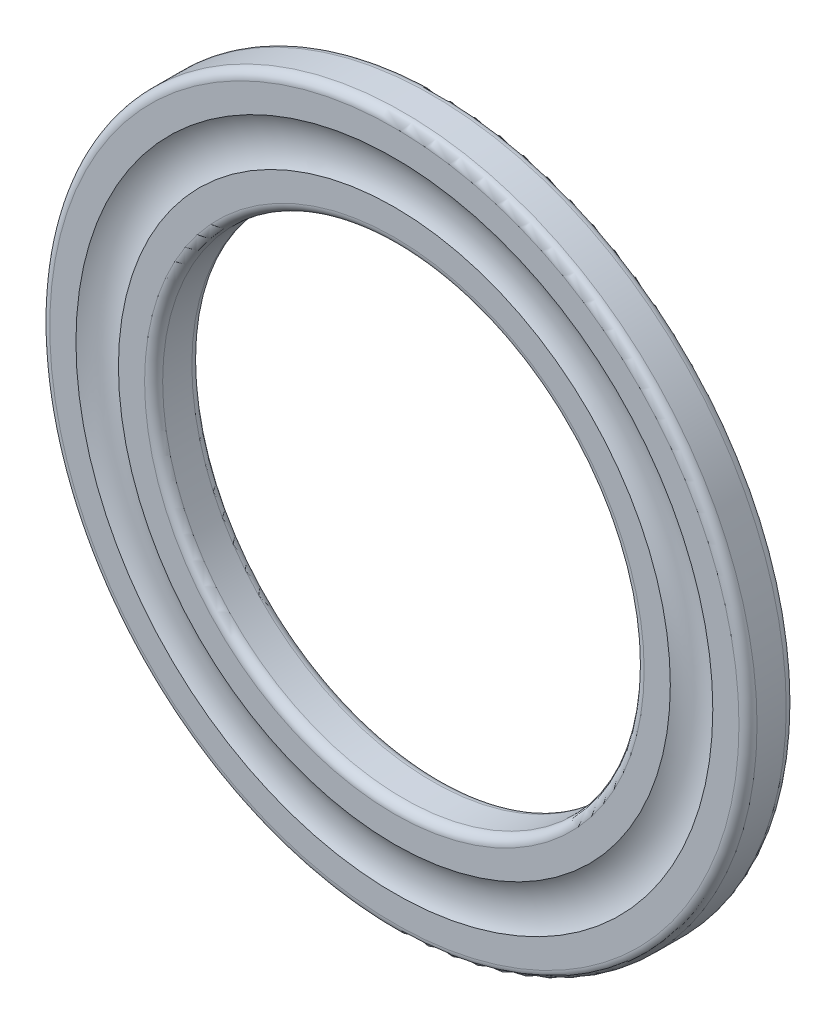
from build123d import *

# Parameters (mm, degrees)
ESQUISSE1_R        = 23.5
ESQUISSE1_R_2      = 16
BOSS_EXTRU_1_DEPTH = 3.14
ESQUISSE2_R        = 2.75
CONG_1_R           = 0.6
ENROULEMENT2_START = -0.1
ENROULEMENT2_DEPTH = 0.1


# Read off the part's stored shape, not the designer's step: Enroulement2
with BuildPart() as part:
    # Esquisse1 → Boss.-Extru.1 (new body)
    with BuildSketch(Plane.XY):
        Circle(ESQUISSE1_R)
        Circle(ESQUISSE1_R_2, mode=Mode.SUBTRACT)
    extrude(amount=BOSS_EXTRU_1_DEPTH)

    # Esquisse2 → Enlèvement de matière-Révolution1 (revolve, cut)
    with BuildSketch(Plane(origin=(0, 0, 0), x_dir=(1, 0, 0), z_dir=(0, 1, 0)), mode=Mode.PRIVATE) as enl_vement_de_mati_re_r_volution1_sk:
        with Locations((19.75, -5.5)):
            Circle(ESQUISSE2_R)
    revolve(enl_vement_de_mati_re_r_volution1_sk.sketch.rotate(Axis((0, 0, 0), (0, 0, 1)), 180), axis=Axis((0, 0, 0), (0, 0, 1)), mode=Mode.SUBTRACT)

    # Congé1
    cong_1_edges = [part.edges().sort_by_distance(p)[0] for p in [
        (-23.5, 0, 0),
        (-23.5, 0, 3.14),
        (-16, 0, 0),
        (-16, 0, 3.14),
    ]]
    fillet(cong_1_edges, radius=CONG_1_R)

    # Enroulement2 outline → Enroulement2 (cut)
    # profile 1 of 8: a face of its own
    with BuildSketch(Plane(origin=(0, 0, 0), x_dir=(-1, 0, 0), z_dir=(0, 0, -1)).offset(ENROULEMENT2_START)):
        with BuildLine():
            add(Edge.make_bspline(
                [(3.714295998, -18.613120903), (3.685048727, -18.575685711), (3.629200866, -18.504202958), (3.538751716, -18.41001704), (3.44854473, -18.331535518), (3.357447083, -18.269500239), (3.265411424, -18.22493459), (3.173411821, -18.195855975), (3.080309986, -18.184330345), (3.019115051, -18.189923964), (2.988599884, -18.19271325)],
                knots=[0, 0, 0, 0, 0.161736123, 0.308836224, 0.444035035, 0.568418723, 0.683082878, 0.791131641, 0.895846728, 1, 1, 1, 1], degree=3))
            Line((3.714295998, -18.613120903), (3.956618714, -18.413411367))
            add(Edge.make_bspline(
                [(2.912913787, -17.893148947), (2.936411932, -17.890039153), (2.983062328, -17.883865341), (3.053036037, -17.880904148), (3.122109493, -17.882757294), (3.190179073, -17.889643378), (3.257219968, -17.902126478), (3.323608956, -17.918137984), (3.388533311, -17.941078226), (3.453208504, -17.967560324), (3.517370146, -18.00029591), (3.580850013, -18.039827417), (3.643987766, -18.086237481), (3.7077505, -18.138138422), (3.770554843, -18.197522631), (3.832818257, -18.263616164), (3.896207354, -18.335114258), (3.936144022, -18.386874816), (3.956618714, -18.413411367)],
                knots=[0, 0, 0, 0, 0.057710414, 0.114571328, 0.170362336, 0.225906656, 0.281007538, 0.336364313, 0.392050073, 0.448534577, 0.506500863, 0.567258904, 0.630471167, 0.697250649, 0.76739152, 0.84080712, 0.91838515, 1, 1, 1, 1], degree=3))
            add(Edge.make_bspline(
                [(2.152236703, -18.868163971), (2.148894721, -18.84000772), (2.142301634, -18.784460854), (2.142669568, -18.70131326), (2.150654387, -18.619825868), (2.168202028, -18.539955852), (2.193690709, -18.461533419), (2.227516298, -18.384660112), (2.270762145, -18.310054424), (2.321106748, -18.237662506), (2.37784846, -18.16927305), (2.44021152, -18.107435076), (2.507553814, -18.05289933), (2.579528544, -18.005726236), (2.656250877, -17.966038901), (2.7375849, -17.934393643), (2.82329844, -17.909062982), (2.882681742, -17.898517602), (2.912913787, -17.893148947)],
                knots=[0, 0, 0, 0, 0.061893002, 0.122102984, 0.181230863, 0.240460236, 0.300364831, 0.361122759, 0.423567834, 0.488450692, 0.553562922, 0.617426091, 0.679994711, 0.742554759, 0.805113093, 0.868328059, 0.932965801, 1, 1, 1, 1], degree=3))
            add(Edge.make_bspline(
                [(3.010224484, -19.766220863), (2.973828764, -19.746760427), (2.903408895, -19.709107611), (2.803311797, -19.650156391), (2.711309352, -19.592715714), (2.627478305, -19.535885755), (2.551964495, -19.480060655), (2.484124133, -19.425719016), (2.425314199, -19.371266867), (2.358517521, -19.301561588), (2.289659504, -19.212145367), (2.223378438, -19.101377845), (2.176167688, -18.986594504), (2.160144238, -18.907297069), (2.152236703, -18.868163971)],
                knots=[0, 0, 0, 0, 0.096005536, 0.185755284, 0.270188288, 0.348299802, 0.421296901, 0.48861994, 0.550397621, 0.607610258, 0.713072398, 0.812124623, 0.907283943, 1, 1, 1, 1], degree=3))
            add(Edge.make_bspline(
                [(3.461797, -20.018083843), (3.454408375, -20.013158338), (3.436490541, -20.001213709), (3.404161956, -19.981836495), (3.361988171, -19.95779559), (3.310647329, -19.928431581), (3.249228969, -19.894772949), (3.178305841, -19.856003725), (3.097339293, -19.812898334), (3.040321686, -19.782347412), (3.010224484, -19.766220863)],
                knots=[0, 0, 0, 0, 0.05150233, 0.124896073, 0.218550018, 0.333100489, 0.467951629, 0.62478523, 0.801939867, 1, 1, 1, 1], degree=3))
            add(Edge.make_bspline(
                [(3.719384139, -20.395242297), (3.716331299, -20.378419005), (3.710223741, -20.344762067), (3.69492707, -20.295543958), (3.67348773, -20.24858832), (3.647839737, -20.201947138), (3.613710922, -20.156566816), (3.572434013, -20.109500247), (3.520159968, -20.06373028), (3.481875366, -20.033787395), (3.461797, -20.018083843)],
                knots=[0, 0, 0, 0, 0.109098253, 0.218263653, 0.327931352, 0.438232009, 0.55734855, 0.689646764, 0.837235186, 1, 1, 1, 1], degree=3))
            add(Edge.make_bspline(
                [(3.349857897, -20.856991095), (3.379834832, -20.851053243), (3.437916154, -20.839548456), (3.517945878, -20.805306749), (3.587250165, -20.758054408), (3.643649031, -20.697966252), (3.686833742, -20.629393843), (3.715959426, -20.555272677), (3.726973187, -20.475757224), (3.721960361, -20.422574357), (3.719384139, -20.395242297)],
                knots=[0, 0, 0, 0, 0.138440972, 0.268234054, 0.392111034, 0.516703857, 0.639540735, 0.758051777, 0.875656508, 1, 1, 1, 1], degree=3))
            add(Edge.make_bspline(
                [(2.720836463, -20.559334845), (2.737902983, -20.575983853), (2.770977447, -20.608249189), (2.820408562, -20.652961862), (2.866851463, -20.693563489), (2.911532727, -20.728670599), (2.954015402, -20.758837925), (2.993381971, -20.785597096), (3.031031508, -20.806435091), (3.077360989, -20.828714075), (3.135439737, -20.847528929), (3.20592135, -20.861043636), (3.277936286, -20.865495634), (3.325723949, -20.85984487), (3.349857897, -20.856991095)],
                knots=[0, 0, 0, 0, 0.098554902, 0.190996793, 0.27550786, 0.353530106, 0.425765429, 0.490911009, 0.550159448, 0.603478001, 0.703252904, 0.801401682, 0.899702953, 1, 1, 1, 1], degree=3))
            Line((2.720836463, -20.559334845), (2.49377817, -20.791481279))
            add(Edge.make_bspline(
                [(3.391835061, -21.180724068), (3.355205275, -21.184975745), (3.282675759, -21.193394362), (3.173352999, -21.187133648), (3.065569456, -21.168998874), (2.977233904, -21.141358104), (2.906887066, -21.110822887), (2.852245382, -21.082146421), (2.796163016, -21.047409878), (2.738312185, -21.007425774), (2.679399729, -20.961402211), (2.618498936, -20.910308857), (2.556547554, -20.852986913), (2.515088643, -20.812362704), (2.49377817, -20.791481279)],
                knots=[0, 0, 0, 0, 0.108170094, 0.214184287, 0.32038316, 0.428743212, 0.485099721, 0.545561823, 0.609876982, 0.678821984, 0.752086373, 0.829451871, 0.912335822, 1, 1, 1, 1], degree=3))
            add(Edge.make_bspline(
                [(4.041209059, -20.334184605), (4.04514122, -20.367633669), (4.052894978, -20.433591281), (4.047701129, -20.532519141), (4.030577888, -20.62873738), (4.000664341, -20.72162622), (3.95869297, -20.809290029), (3.905592773, -20.890724518), (3.839627296, -20.963342144), (3.764533864, -21.028712657), (3.680269287, -21.083929822), (3.589841953, -21.128674998), (3.493128259, -21.161787781), (3.425956843, -21.174345161), (3.391835061, -21.180724068)],
                knots=[0, 0, 0, 0, 0.084769184, 0.167154837, 0.248606122, 0.330574719, 0.412325255, 0.492958941, 0.574709477, 0.6588191, 0.743306487, 0.827913794, 0.912583528, 1, 1, 1, 1], degree=3))
            add(Edge.make_bspline(
                [(3.803974484, -19.880068018), (3.819846802, -19.896642791), (3.851133048, -19.929313658), (3.89433122, -19.980742228), (3.930917075, -20.035354481), (3.963885693, -20.091033454), (3.990193702, -20.14934324), (4.012970459, -20.208830091), (4.03025102, -20.270586678), (4.037543158, -20.31290856), (4.041209059, -20.334184605)],
                knots=[0, 0, 0, 0, 0.131998693, 0.260185272, 0.385669427, 0.509699404, 0.631917746, 0.753091337, 0.875874145, 1, 1, 1, 1], degree=3))
            add(Edge.make_bspline(
                [(3.2525472, -19.525170181), (3.28711074, -19.544449299), (3.353181938, -19.581303), (3.44763184, -19.634254085), (3.531231864, -19.68470891), (3.605586593, -19.73037289), (3.669675872, -19.772774144), (3.723826962, -19.811508675), (3.768256796, -19.846031089), (3.792890538, -19.869505646), (3.803974484, -19.880068018)],
                knots=[0, 0, 0, 0, 0.180636593, 0.345302474, 0.494155476, 0.626262922, 0.743540568, 0.844775889, 0.930156949, 1, 1, 1, 1], degree=3))
            add(Edge.make_bspline(
                [(2.641970277, -19.103490494), (2.657864931, -19.119622172), (2.69127839, -19.1535339), (2.748316542, -19.202001202), (2.812863717, -19.252434683), (2.885285463, -19.30431307), (2.965591481, -19.357913837), (3.054223199, -19.412189258), (3.150163195, -19.469176434), (3.217657849, -19.506089217), (3.2525472, -19.525170181)],
                knots=[0, 0, 0, 0, 0.091196034, 0.191710684, 0.30122775, 0.421166063, 0.550503855, 0.690108004, 0.839810562, 1, 1, 1, 1], degree=3))
            add(Edge.make_bspline(
                [(2.489326046, -18.810922385), (2.49452576, -18.837074035), (2.505001344, -18.889760361), (2.5386139, -18.964835647), (2.582981767, -19.037849639), (2.621914448, -19.081172898), (2.641970277, -19.103490494)],
                knots=[0, 0, 0, 0, 0.238045701, 0.479577895, 0.731909123, 1, 1, 1, 1], degree=3))
            add(Edge.make_bspline(
                [(2.988599884, -18.19271325), (2.962803604, -18.197628775), (2.911696439, -18.207367332), (2.837763919, -18.232448082), (2.76819394, -18.267244575), (2.70325756, -18.309651539), (2.643867591, -18.357876395), (2.594149341, -18.413217991), (2.552499878, -18.473001927), (2.521096086, -18.537735009), (2.498795609, -18.604967071), (2.486060992, -18.673406288), (2.481556864, -18.742359315), (2.486734662, -18.788053411), (2.489326046, -18.810922385)],
                knots=[0, 0, 0, 0, 0.089096018, 0.176515565, 0.264086155, 0.35254294, 0.439463079, 0.523045776, 0.604317853, 0.686095313, 0.766456785, 0.844112478, 0.921981437, 1, 1, 1, 1], degree=3))
        make_face()
    # profile 2 of 8: a face of its own
    with BuildSketch(Plane(origin=(0, 0, 0), x_dir=(-1, 0, 0), z_dir=(0, 0, -1)).offset(ENROULEMENT2_START)):
        with BuildLine():
            add(Edge.make_bspline(
                [(-5.054863862, 19.565635326), (-5.02456043, 19.582406127), (-4.965936181, 19.614850493), (-4.877093332, 19.654703478), (-4.791881681, 19.687347909), (-4.735090227, 19.702618861), (-4.707598237, 19.710011327)],
                knots=[0, 0, 0, 0, 0.275309015, 0.532605813, 0.773740671, 1, 1, 1, 1], degree=3))
            Line((-5.054863862, 19.565635326), (-5.103201201, 20.438887529))
            Line((-5.103201201, 20.438887529), (-4.009886898, 20.701562809))
            Line((-4.009886898, 20.701562809), (-4.079848838, 20.994130918))
            Line((-4.079848838, 20.994130918), (-5.409125681, 20.674850069))
            Line((-5.409125681, 20.674850069), (-5.327079406, 19.082261928))
            add(Edge.make_bspline(
                [(-4.709506289, 19.405994901), (-4.732506736, 19.399978887), (-4.779911038, 19.387579782), (-4.851189031, 19.361617167), (-4.924908532, 19.329612588), (-5.001134007, 19.292093987), (-5.079703907, 19.248645457), (-5.160240678, 19.198727057), (-5.243798727, 19.143714485), (-5.298854754, 19.103088812), (-5.327079406, 19.082261928)],
                knots=[0, 0, 0, 0, 0.101592528, 0.209383881, 0.323871841, 0.445069353, 0.572453192, 0.707536414, 0.850067588, 1, 1, 1, 1], degree=3))
            add(Edge.make_bspline(
                [(-3.821625681, 18.878736287), (-3.828445507, 18.90387301), (-3.841784816, 18.953039432), (-3.868064933, 19.023608063), (-3.899511845, 19.089307899), (-3.937565125, 19.149134694), (-3.979536656, 19.204611883), (-4.027601657, 19.254262031), (-4.080665787, 19.298997935), (-4.13832664, 19.33840235), (-4.20026556, 19.371389811), (-4.265060532, 19.398447275), (-4.333033505, 19.417398491), (-4.403356505, 19.429551898), (-4.476225887, 19.434504368), (-4.551837136, 19.432621369), (-4.630093726, 19.422810809), (-4.682653296, 19.411681123), (-4.709506289, 19.405994901)],
                knots=[0, 0, 0, 0, 0.067148129, 0.131339051, 0.19394535, 0.254630959, 0.313908358, 0.373077211, 0.43244785, 0.492658612, 0.552839571, 0.613157004, 0.673395071, 0.734434392, 0.796923573, 0.861467527, 0.929222943, 1, 1, 1, 1], degree=3))
            add(Edge.make_bspline(
                [(-4.365420753, 17.898633122), (-4.340650567, 17.905301332), (-4.291983354, 17.918402695), (-4.222720942, 17.947162982), (-4.157367131, 17.981264021), (-4.097054173, 18.022846639), (-4.040949234, 18.070516544), (-3.989225631, 18.124771466), (-3.942424414, 18.186071368), (-3.900009931, 18.252613417), (-3.862918662, 18.323141073), (-3.834754909, 18.39726334), (-3.812595904, 18.472863277), (-3.798506389, 18.55045639), (-3.793223658, 18.630171968), (-3.794109306, 18.711516775), (-3.804055813, 18.794915857), (-3.815687319, 18.850406192), (-3.821625681, 18.878736287)],
                knots=[0, 0, 0, 0, 0.061596975, 0.121022633, 0.179833376, 0.238489382, 0.296689866, 0.356520511, 0.418285876, 0.481755576, 0.546026174, 0.609428334, 0.672003963, 0.735174304, 0.7985273, 0.863760326, 0.93044405, 1, 1, 1, 1], degree=3))
            add(Edge.make_bspline(
                [(-5.134366065, 18.278971664), (-5.121132761, 18.25216817), (-5.095681068, 18.200616853), (-5.050022738, 18.130815163), (-5.001024213, 18.070216054), (-4.947055869, 18.019030862), (-4.887182966, 17.977455097), (-4.822855152, 17.941931709), (-4.752017139, 17.914973228), (-4.677168095, 17.894019711), (-4.59931384, 17.881048018), (-4.520790018, 17.878374135), (-4.442387063, 17.882788361), (-4.3911944, 17.893327199), (-4.365420753, 17.898633122)],
                knots=[0, 0, 0, 0, 0.09577893, 0.184212177, 0.266817199, 0.345208263, 0.421786157, 0.499967655, 0.580257619, 0.664208381, 0.748923607, 0.832609714, 0.91572507, 1, 1, 1, 1], degree=3))
            Line((-5.134366065, 18.278971664), (-5.449830809, 18.203285566))
            add(Edge.make_bspline(
                [(-4.31517536, 17.608609084), (-4.345817168, 17.60188086), (-4.406276209, 17.58860547), (-4.497258705, 17.579006322), (-4.586190575, 17.575908272), (-4.673247148, 17.581979615), (-4.758513942, 17.59499384), (-4.841815026, 17.616848607), (-4.922796048, 17.647049382), (-5.001404827, 17.684373662), (-5.076134484, 17.728669062), (-5.145833522, 17.779278968), (-5.2105755, 17.835446628), (-5.26950329, 17.897861306), (-5.323383826, 17.965585557), (-5.3712258, 18.039399797), (-5.413898751, 18.11881216), (-5.43775175, 18.174888662), (-5.449830809, 18.203285566)],
                knots=[0, 0, 0, 0, 0.066891654, 0.131983244, 0.194887758, 0.256543716, 0.317900243, 0.378685469, 0.43994353, 0.502062402, 0.564126896, 0.625023115, 0.685621213, 0.746737138, 0.807918319, 0.870025661, 0.934181544, 1, 1, 1, 1], degree=3))
            add(Edge.make_bspline(
                [(-3.503616866, 18.942974068), (-3.493092628, 18.89313852), (-3.472332679, 18.794833692), (-3.465900999, 18.645181627), (-3.47590908, 18.497619171), (-3.502104704, 18.377542556), (-3.530642841, 18.284065857), (-3.556801626, 18.216786528), (-3.586641971, 18.152345251), (-3.620647991, 18.091063127), (-3.657980005, 18.03228677), (-3.700133742, 17.9769769), (-3.746260224, 17.924717861), (-3.795517538, 17.874904624), (-3.849306411, 17.829580007), (-3.905320674, 17.786121114), (-3.965736689, 17.747923044), (-4.029169979, 17.712541128), (-4.095709852, 17.681004081), (-4.165655004, 17.652564939), (-4.239150828, 17.628778819), (-4.289670638, 17.615375629), (-4.31517536, 17.608609084)],
                knots=[0, 0, 0, 0, 0.087187762, 0.171985227, 0.25580812, 0.34013694, 0.381983328, 0.423291175, 0.463780228, 0.50363628, 0.543359534, 0.583049518, 0.622711201, 0.662803535, 0.70301431, 0.743213585, 0.784247097, 0.82540918, 0.867678024, 0.910400716, 0.954766164, 1, 1, 1, 1], degree=3))
            add(Edge.make_bspline(
                [(-4.707598237, 19.710011327), (-4.67315899, 19.717493344), (-4.605588396, 19.732173232), (-4.503875641, 19.741943065), (-4.404665932, 19.742793299), (-4.307839495, 19.734123656), (-4.213535015, 19.714942007), (-4.122084376, 19.685132652), (-4.032683282, 19.646586534), (-3.947248635, 19.597223826), (-3.866122341, 19.540696596), (-3.79193776, 19.475873646), (-3.724789538, 19.4044802), (-3.665329127, 19.325781174), (-3.61388579, 19.240034721), (-3.569087624, 19.147726325), (-3.531202011, 19.048409758), (-3.51293189, 18.978577867), (-3.503616866, 18.942974068)],
                knots=[0, 0, 0, 0, 0.065998311, 0.129490208, 0.191075089, 0.251722368, 0.311331317, 0.37101437, 0.431688974, 0.493437685, 0.555606781, 0.616716909, 0.677713273, 0.738979484, 0.801190462, 0.86480531, 0.931070967, 1, 1, 1, 1], degree=3))
        make_face()
    # profile 3 of 8: a face of its own
    with BuildSketch(Plane(origin=(0, 0, 0), x_dir=(-1, 0, 0), z_dir=(0, 0, -1)).offset(ENROULEMENT2_START)):
        with BuildLine():
            add(Edge.make_bspline(
                [(3.508547924, 21.140801286), (3.533225604, 21.13609159), (3.582169523, 21.126750721), (3.653611533, 21.106175661), (3.722284575, 21.080457737), (3.789076114, 21.051126107), (3.851783714, 21.014123873), (3.912631154, 20.97353247), (3.970591869, 20.927477439), (4.0259686, 20.87658121), (4.078266237, 20.820772338), (4.125849202, 20.759488635), (4.169552867, 20.69341791), (4.2085963, 20.622153786), (4.244414411, 20.546457409), (4.275599258, 20.465613504), (4.302857566, 20.380037173), (4.325690314, 20.289127319), (4.344726974, 20.192665121), (4.356041311, 20.08947732), (4.363193124, 19.979765059), (4.364445773, 19.863195348), (4.35879601, 19.739939962), (4.348736935, 19.61008576), (4.332783174, 19.473666064), (4.318105448, 19.380892724), (4.310566153, 19.333239186)],
                knots=[0, 0, 0, 0, 0.03394457, 0.067323194, 0.100325766, 0.133029654, 0.165764912, 0.1985891, 0.231840788, 0.265709071, 0.300176967, 0.335086344, 0.370453753, 0.407137484, 0.444824861, 0.483565161, 0.524165296, 0.566143647, 0.610204472, 0.656944843, 0.706333282, 0.758776284, 0.814415525, 0.87305261, 0.934792772, 1, 1, 1, 1], degree=3))
            add(Edge.make_bspline(
                [(2.195171521, 19.686864987), (2.203709736, 19.736544005), (2.220292248, 19.833028207), (2.250455028, 19.97230611), (2.282642976, 20.102199044), (2.317651709, 20.22271383), (2.354882983, 20.334037027), (2.394916202, 20.43596964), (2.437136919, 20.528728036), (2.483648344, 20.612003761), (2.531976676, 20.688117909), (2.583290984, 20.757763165), (2.636533133, 20.822161358), (2.692597675, 20.880881658), (2.751164813, 20.933694215), (2.812077807, 20.981210174), (2.875381955, 21.023434523), (2.94187115, 21.058530044), (3.009069453, 21.089666418), (3.078108564, 21.113399459), (3.147666243, 21.132866359), (3.218277298, 21.146389429), (3.289824054, 21.15301326), (3.362073836, 21.155104813), (3.435279698, 21.151465268), (3.483998594, 21.144374371), (3.508547924, 21.140801286)],
                knots=[0, 0, 0, 0, 0.068597073, 0.133225942, 0.193899455, 0.25069548, 0.303982312, 0.353598434, 0.399687063, 0.442565937, 0.483307193, 0.522319755, 0.56022394, 0.596958024, 0.632710089, 0.667455982, 0.702027722, 0.736109539, 0.76968437, 0.802719249, 0.835339472, 0.867935439, 0.900407294, 0.933023689, 0.966250804, 1, 1, 1, 1], degree=3))
            add(Edge.make_bspline(
                [(2.964116834, 17.885663064), (2.939627364, 17.890070591), (2.891215867, 17.898783519), (2.821116022, 17.919911433), (2.753350979, 17.944468064), (2.688403671, 17.974360732), (2.626389399, 18.0096256), (2.567047544, 18.049813248), (2.510362643, 18.095199013), (2.45618615, 18.1452198), (2.406065327, 18.200794251), (2.359490377, 18.260583126), (2.317198796, 18.325164602), (2.280118506, 18.394660216), (2.245890876, 18.468387994), (2.216334019, 18.546882058), (2.190909861, 18.630210092), (2.168922395, 18.718392517), (2.152394125, 18.81314778), (2.141753796, 18.915144843), (2.137120175, 19.024925476), (2.136805376, 19.142306518), (2.143830987, 19.267464811), (2.155427946, 19.400429588), (2.17146597, 19.541410651), (2.187130433, 19.637525861), (2.195171521, 19.686864987)],
                knots=[0, 0, 0, 0, 0.033865939, 0.066947175, 0.099562588, 0.1319934, 0.164193264, 0.196630503, 0.22950693, 0.263016428, 0.29695124, 0.33131945, 0.366159964, 0.401950853, 0.438516188, 0.476809224, 0.516085877, 0.557127479, 0.60051957, 0.646982463, 0.696704203, 0.750126227, 0.806798314, 0.867374179, 0.931918766, 1, 1, 1, 1], degree=3))
            add(Edge.make_bspline(
                [(4.310566153, 19.333239186), (4.302134848, 19.285913649), (4.285717362, 19.193761086), (4.257354225, 19.059734921), (4.224774448, 18.934277321), (4.190175751, 18.816450651), (4.151125491, 18.707368525), (4.110322074, 18.605657782), (4.064898684, 18.512906469), (4.017250891, 18.42750123), (3.96574368, 18.349978203), (3.913401525, 18.277456537), (3.857053244, 18.212130023), (3.798963787, 18.151923901), (3.738774881, 18.097066243), (3.675656619, 18.048439294), (3.609573498, 18.006505111), (3.54200672, 17.969413234), (3.472301081, 17.939298513), (3.402298238, 17.913178957), (3.330858394, 17.894388701), (3.258803438, 17.880887551), (3.186058648, 17.873238749), (3.112705306, 17.871407396), (3.038453731, 17.875017947), (2.989091377, 17.882086685), (2.964116834, 17.885663064)],
                knots=[0, 0, 0, 0, 0.064995417, 0.126559459, 0.185169637, 0.240220012, 0.292533497, 0.34177305, 0.388310965, 0.432080036, 0.473900183, 0.514091163, 0.552925193, 0.590428776, 0.627161973, 0.66293872, 0.698005613, 0.732893964, 0.767034757, 0.800586819, 0.833823924, 0.866770504, 0.899629676, 0.932606171, 0.965902557, 1, 1, 1, 1], degree=3))
        make_face()
        with BuildLine():
            add(Edge.make_bspline(
                [(3.02135842, 18.164874803), (3.055655984, 18.160642957), (3.124040972, 18.152205193), (3.228171229, 18.162224972), (3.331022064, 18.189554967), (3.414693858, 18.226057882), (3.480077247, 18.263539161), (3.527961166, 18.297199343), (3.572815175, 18.336681018), (3.617247166, 18.378948448), (3.658538921, 18.427183642), (3.697818441, 18.480029787), (3.735523145, 18.537319106), (3.758323263, 18.577928374), (3.769951169, 18.598638826)],
                knots=[0, 0, 0, 0, 0.111594558, 0.222505382, 0.336033145, 0.454986504, 0.516787566, 0.579814922, 0.644056162, 0.710062123, 0.778175185, 0.849275717, 0.923131639, 1, 1, 1, 1], degree=3))
            add(Edge.make_bspline(
                [(2.48773963, 19.631531454), (2.481003146, 19.589156204), (2.46792101, 19.506864192), (2.451620206, 19.386916062), (2.441098269, 19.274420751), (2.433863462, 19.16944966), (2.430418159, 19.072072744), (2.431529214, 18.982064487), (2.437028546, 18.899639967), (2.447219583, 18.824024829), (2.461486266, 18.754029216), (2.478552727, 18.688096884), (2.499351968, 18.625714992), (2.524436445, 18.567335968), (2.551712776, 18.51201738), (2.582801047, 18.460389258), (2.618116215, 18.412622861), (2.668003366, 18.354206988), (2.736251139, 18.291085992), (2.82572797, 18.231125641), (2.920710453, 18.18674875), (2.987906906, 18.172144862), (3.02135842, 18.164874803)],
                knots=[0, 0, 0, 0, 0.073772725, 0.143265372, 0.208080704, 0.267994813, 0.324159075, 0.375560285, 0.422696495, 0.466102385, 0.506635279, 0.545448418, 0.583141386, 0.61956513, 0.654613191, 0.689120653, 0.723022129, 0.756628376, 0.821116941, 0.882078601, 0.941296763, 1, 1, 1, 1], degree=3))
            add(Edge.make_bspline(
                [(3.469750848, 20.845053088), (3.435442152, 20.849084187), (3.366998608, 20.857125958), (3.262515438, 20.846232527), (3.158649878, 20.818607373), (3.074103619, 20.780825056), (3.008045194, 20.742779065), (2.960108568, 20.70845673), (2.913657643, 20.670577035), (2.869435581, 20.627554204), (2.82789867, 20.579712539), (2.787205847, 20.52820829), (2.750217539, 20.471011393), (2.713157967, 20.409900126), (2.679478935, 20.341405753), (2.647000019, 20.26540916), (2.615891607, 20.180745947), (2.586866196, 20.087283148), (2.559806883, 19.985323), (2.533526601, 19.875123632), (2.509650541, 19.756243185), (2.495194809, 19.673964573), (2.48773963, 19.631531454)],
                knots=[0, 0, 0, 0, 0.059229564, 0.118159002, 0.179243179, 0.243370659, 0.276686814, 0.310156101, 0.344593559, 0.379644569, 0.416054235, 0.453451845, 0.492367128, 0.533056015, 0.576246745, 0.623430509, 0.675086374, 0.731221252, 0.791601227, 0.85639629, 0.925940008, 1, 1, 1, 1], degree=3))
            add(Edge.make_bspline(
                [(4.019270079, 19.37521635), (4.025473846, 19.413337986), (4.037612514, 19.487929102), (4.050889094, 19.597836978), (4.059777066, 19.702860721), (4.064959242, 19.802983295), (4.066475993, 19.898465026), (4.063453854, 19.989336529), (4.055686249, 20.075492757), (4.044491181, 20.157067463), (4.028925103, 20.233766517), (4.011581728, 20.306202021), (3.989662812, 20.373614891), (3.965360302, 20.436864561), (3.936234564, 20.494709587), (3.905340736, 20.548761071), (3.870161959, 20.597780056), (3.820067278, 20.656091196), (3.752163164, 20.718842301), (3.663632732, 20.778616491), (3.569629763, 20.823301545), (3.503004956, 20.837811038), (3.469750848, 20.845053088)],
                knots=[0, 0, 0, 0, 0.066414562, 0.129950778, 0.190323477, 0.247637604, 0.302330234, 0.354497767, 0.403910822, 0.451036888, 0.49601109, 0.538455125, 0.579040508, 0.617834148, 0.654846272, 0.690301122, 0.7248002, 0.758413288, 0.822399796, 0.883071186, 0.941637903, 1, 1, 1, 1], degree=3))
            add(Edge.make_bspline(
                [(3.769951169, 18.598638826), (3.784059208, 18.625190461), (3.812776969, 18.679237909), (3.850377363, 18.764753053), (3.886148684, 18.854651736), (3.919349164, 18.949138739), (3.948325768, 19.048881752), (3.974994614, 19.153253125), (3.999362074, 19.262426195), (4.01256198, 19.33721116), (4.019270079, 19.37521635)],
                knots=[0, 0, 0, 0, 0.110057127, 0.224027884, 0.341797619, 0.464302281, 0.590554377, 0.721970132, 0.858707191, 1, 1, 1, 1], degree=3))
        make_face(mode=Mode.SUBTRACT)
    # profile 4 of 8: a face of its own
    with BuildSketch(Plane(origin=(0, 0, 0), x_dir=(-1, 0, 0), z_dir=(0, 0, -1)).offset(ENROULEMENT2_START)):
        with BuildLine():
            add(Edge.make_bspline(
                [(5.702329895, 19.151012565), (5.731599928, 19.151264605), (5.788963691, 19.151758557), (5.872570125, 19.14466649), (5.951760722, 19.131518663), (6.001991886, 19.11772707), (6.026698885, 19.110943455)],
                knots=[0, 0, 0, 0, 0.267435457, 0.524123232, 0.765932423, 1, 1, 1, 1], degree=3))
            Line((5.702329895, 19.151012565), (6.896771, 20.131751748))
            Line((6.896771, 20.131751748), (6.698969518, 20.370258358))
            Line((6.698969518, 20.370258358), (5.363968516, 19.28902839))
            add(Edge.make_bspline(
                [(4.749575488, 18.51690299), (4.760179223, 18.547898739), (4.781750389, 18.610953357), (4.826713393, 18.702469619), (4.88013717, 18.794066912), (4.933632504, 18.868727611), (4.982375721, 18.92909831), (5.023425364, 18.976503803), (5.069087505, 19.025247194), (5.119164503, 19.075291217), (5.17416322, 19.126731759), (5.232915343, 19.180214845), (5.296973104, 19.234209256), (5.34123775, 19.270428894), (5.363968516, 19.28902839)],
                knots=[0, 0, 0, 0, 0.098031011, 0.19942438, 0.304734676, 0.415384737, 0.474092734, 0.53711342, 0.603155148, 0.674097748, 0.749114983, 0.828691327, 0.912029625, 1, 1, 1, 1], degree=3))
            add(Edge.make_bspline(
                [(5.377960904, 17.31292162), (5.337624485, 17.326847769), (5.257864388, 17.354384944), (5.147333604, 17.415135928), (5.044971151, 17.487287705), (4.952972629, 17.572914856), (4.873640016, 17.670217784), (4.807790609, 17.776684237), (4.758026555, 17.892246302), (4.723999206, 18.01467275), (4.705690664, 18.140799894), (4.70299691, 18.267696946), (4.716542402, 18.394039364), (4.738521114, 18.475787229), (4.749575488, 18.51690299)],
                knots=[0, 0, 0, 0, 0.084526081, 0.16713949, 0.249185605, 0.332515439, 0.415615668, 0.497564693, 0.580077392, 0.664372928, 0.748958638, 0.832256621, 0.915632089, 1, 1, 1, 1], degree=3))
            add(Edge.make_bspline(
                [(6.606746962, 17.948939248), (6.592102389, 17.906957006), (6.56332517, 17.824460082), (6.502813986, 17.709675108), (6.428782568, 17.606120864), (6.342494875, 17.513995337), (6.244806258, 17.434624449), (6.137008166, 17.369989999), (6.01979985, 17.319789088), (5.894800075, 17.285564714), (5.765351671, 17.266087909), (5.634970607, 17.264540969), (5.504800361, 17.278576705), (5.420551693, 17.301389112), (5.377960904, 17.31292162)],
                knots=[0, 0, 0, 0, 0.086351253, 0.169683956, 0.251233146, 0.333172007, 0.414344308, 0.495139013, 0.576752757, 0.661452357, 0.74643929, 0.83053098, 0.914327199, 1, 1, 1, 1], degree=3))
            add(Edge.make_bspline(
                [(6.026698885, 19.110943455), (6.055753448, 19.101125576), (6.113038924, 19.081768139), (6.19400316, 19.043269347), (6.269307052, 18.997754555), (6.338408709, 18.944899063), (6.402302821, 18.885516467), (6.458520834, 18.817884248), (6.510894739, 18.744702321), (6.554936309, 18.664218516), (6.593634488, 18.580431314), (6.62167307, 18.493562868), (6.642870019, 18.40606016), (6.653149791, 18.316851057), (6.656179603, 18.226339333), (6.648705883, 18.134554723), (6.632958708, 18.041449235), (6.615598194, 17.980178196), (6.606746962, 17.948939248)],
                knots=[0, 0, 0, 0, 0.063540108, 0.125278955, 0.18543439, 0.245654024, 0.305358125, 0.36585943, 0.4276874, 0.491641207, 0.555774511, 0.618740385, 0.68057929, 0.742131659, 0.804572186, 0.868051453, 0.932726228, 1, 1, 1, 1], degree=3))
        make_face()
        with BuildLine():
            add(Edge.make_bspline(
                [(5.044051649, 18.430404592), (5.037835711, 18.408678664), (5.025650217, 18.366087962), (5.015974239, 18.300945149), (5.011006868, 18.236919252), (5.013586963, 18.173093439), (5.023574782, 18.110176483), (5.038489211, 18.047331064), (5.061269649, 17.985548976), (5.089390367, 17.924873857), (5.123885776, 17.867578923), (5.16158025, 17.813707753), (5.204929518, 17.765757923), (5.251680479, 17.722324754), (5.303263278, 17.684767572), (5.358144908, 17.651343596), (5.417588891, 17.62307286), (5.459632384, 17.608883567), (5.48099576, 17.601673623)],
                knots=[0, 0, 0, 0, 0.064989773, 0.127403534, 0.189196455, 0.249670106, 0.310784097, 0.372365657, 0.435305423, 0.500016596, 0.564600996, 0.627605835, 0.688987444, 0.750326556, 0.81099701, 0.872336121, 0.935130711, 1, 1, 1, 1], degree=3))
            add(Edge.make_bspline(
                [(5.873418637, 18.869256756), (5.851692612, 18.875473073), (5.809101721, 18.887659308), (5.743960278, 18.89732991), (5.679929303, 18.902317204), (5.616122106, 18.899664066), (5.553084186, 18.889943305), (5.490456365, 18.873965089), (5.428522579, 18.851504417), (5.367821534, 18.823038463), (5.310079385, 18.789234501), (5.256670124, 18.75062637), (5.208311401, 18.708232453), (5.165061836, 18.661078394), (5.127073741, 18.609600096), (5.093741838, 18.553853389), (5.065572902, 18.493969964), (5.051281964, 18.451760117), (5.044051649, 18.430404592)],
                knots=[0, 0, 0, 0, 0.064879407, 0.127187175, 0.188875159, 0.249246113, 0.31025632, 0.371881079, 0.434713959, 0.499315239, 0.564314703, 0.626717734, 0.688450839, 0.748824868, 0.810244452, 0.872001608, 0.935240873, 1, 1, 1, 1], degree=3))
            add(Edge.make_bspline(
                [(6.30972673, 18.038617733), (6.315950505, 18.060342393), (6.328209101, 18.103132145), (6.337794235, 18.168719467), (6.34276681, 18.233374124), (6.340228649, 18.297626758), (6.330205174, 18.360755833), (6.315278663, 18.423592142), (6.292550631, 18.485409096), (6.264149187, 18.546115648), (6.230382171, 18.603906534), (6.191652212, 18.657010485), (6.150020196, 18.706095452), (6.1022309, 18.748449471), (6.051396791, 18.786882275), (5.996389159, 18.820306891), (5.936666572, 18.847718467), (5.894757124, 18.861990202), (5.873418637, 18.869256756)],
                knots=[0, 0, 0, 0, 0.064885919, 0.12780188, 0.190103984, 0.251089877, 0.312106208, 0.373589359, 0.436428547, 0.501036311, 0.566042299, 0.628451594, 0.689789624, 0.750620054, 0.811557217, 0.872798309, 0.935234373, 1, 1, 1, 1], degree=3))
            add(Edge.make_bspline(
                [(5.48099576, 17.601673623), (5.502723327, 17.59547666), (5.545317242, 17.583328364), (5.610423275, 17.573384816), (5.674521675, 17.569415433), (5.738226741, 17.572059118), (5.801387705, 17.580800083), (5.863782965, 17.596896244), (5.925415302, 17.619563741), (5.985955222, 17.647886066), (6.043726862, 17.681665236), (6.096890934, 17.720343392), (6.145868769, 17.762258589), (6.189012335, 17.809376217), (6.22664984, 17.86086536), (6.26005207, 17.915772346), (6.288328721, 17.975209432), (6.3025172, 18.017253875), (6.30972673, 18.038617733)],
                knots=[0, 0, 0, 0, 0.065020256, 0.12746329, 0.189245978, 0.249747994, 0.310802158, 0.3725607, 0.434955945, 0.49969747, 0.564838043, 0.627376547, 0.688841569, 0.75020945, 0.810908361, 0.872276243, 0.935100285, 1, 1, 1, 1], degree=3))
        make_face(mode=Mode.SUBTRACT)
    # profile 5 of 8: a face of its own
    with BuildSketch(Plane(origin=(0, 0, 0), x_dir=(-1, 0, 0), z_dir=(0, 0, -1)).offset(ENROULEMENT2_START)):
        Polygon((-0.138214256, -21.367563741), (1.095659943, -20.154042106), (1.122372683, -21.338942947), (1.444197603, -21.331946753), (1.372963629, -18.174119229), (1.051138709, -18.181115423), (1.084211626, -19.653496233), (-0.336015738, -18.212280287), (-0.754515337, -18.221820551), (0.920755095, -19.925711777), (-0.564982084, -21.377104005), align=None)
    # profile 6 of 8: a face of its own
    with BuildSketch(Plane(origin=(0, 0, 0), x_dir=(-1, 0, 0), z_dir=(0, 0, -1)).offset(ENROULEMENT2_START)):
        Polygon((-1.795271565, -21.014332416), (-3.064126733, -20.901121278), (-3.092111509, -21.212769916), (-1.50969965, -21.353965829), (-1.227943841, -18.196138305), (-1.541500531, -18.16815353), (-1.679516357, -19.715584419), (-2.948371525, -19.602373281), (-2.976356301, -19.914021919), (-1.707501132, -20.027233057), align=None)
    # profile 7 of 8: a face of its own
    with BuildSketch(Plane(origin=(0, 0, 0), x_dir=(-1, 0, 0), z_dir=(0, 0, -1)).offset(ENROULEMENT2_START)):
        Polygon((-1.962132052, 18.102167155), (-1.651119432, 18.133968037), (-1.968492229, 21.26253875), (-2.583521275, 21.200209022), (-2.739345594, 20.874567997), (-2.248339985, 20.924177372), align=None)
    # profile 8 of 8: a face of its own
    with BuildSketch(Plane(origin=(0, 0, 0), x_dir=(-1, 0, 0), z_dir=(0, 0, -1)).offset(ENROULEMENT2_START)):
        Polygon((0.482080732, 18.203207334), (0.795637423, 18.193667069), (0.89549219, 21.351494593), (0.274738985, 21.37121114), (0.075665468, 21.067830731), (0.571759218, 21.05193029), align=None)
    extrude(amount=ENROULEMENT2_DEPTH, mode=Mode.SUBTRACT)


solid = part.part
